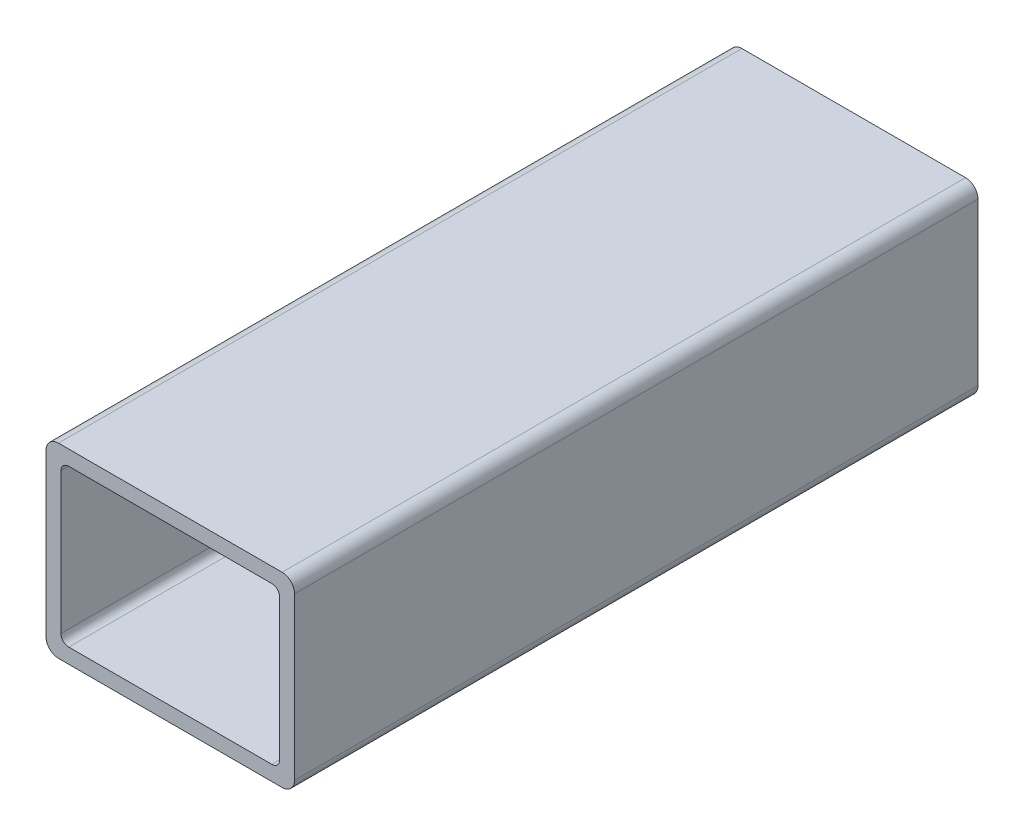
from build123d import *

# Parameters (mm, degrees)
BOSS_EXTRUDE1_DEPTH = 139.7


with BuildPart() as part:
    # Sketch4 → Boss-Extrude1 (new body)
    with BuildSketch(Plane.XY):
        with BuildLine():
            Line((25.4, -16.51), (25.4, 16.51))
            ThreePointArc((25.4, 16.51), (24.656051224, 18.306051224), (22.86, 19.05))
            Line((22.86, 19.05), (-22.86, 19.05))
            ThreePointArc((-22.86, 19.05), (-24.656051224, 18.306051224), (-25.4, 16.51))
            Line((-25.4, 16.51), (-25.4, -16.51))
            ThreePointArc((-25.4, -16.51), (-24.656051224, -18.306051224), (-22.86, -19.05))
            Line((-22.86, -19.05), (22.86, -19.05))
            ThreePointArc((22.86, -19.05), (24.656051224, -18.306051224), (25.4, -16.51))
        make_face()
        with BuildLine():
            Line((22.352, 14.4018), (22.352, -14.4018))
            ThreePointArc((22.352, -14.4018), (21.883312271, -15.533312271), (20.7518, -16.002))
            Line((20.7518, -16.002), (-20.7518, -16.002))
            ThreePointArc((-20.7518, -16.002), (-21.883312271, -15.533312271), (-22.352, -14.4018))
            Line((-22.352, -14.4018), (-22.352, 14.4018))
            ThreePointArc((-22.352, 14.4018), (-21.883312271, 15.533312271), (-20.7518, 16.002))
            Line((-20.7518, 16.002), (20.7518, 16.002))
            ThreePointArc((20.7518, 16.002), (21.883312271, 15.533312271), (22.352, 14.4018))
        make_face(mode=Mode.SUBTRACT)
    extrude(amount=BOSS_EXTRUDE1_DEPTH)


solid = part.part
